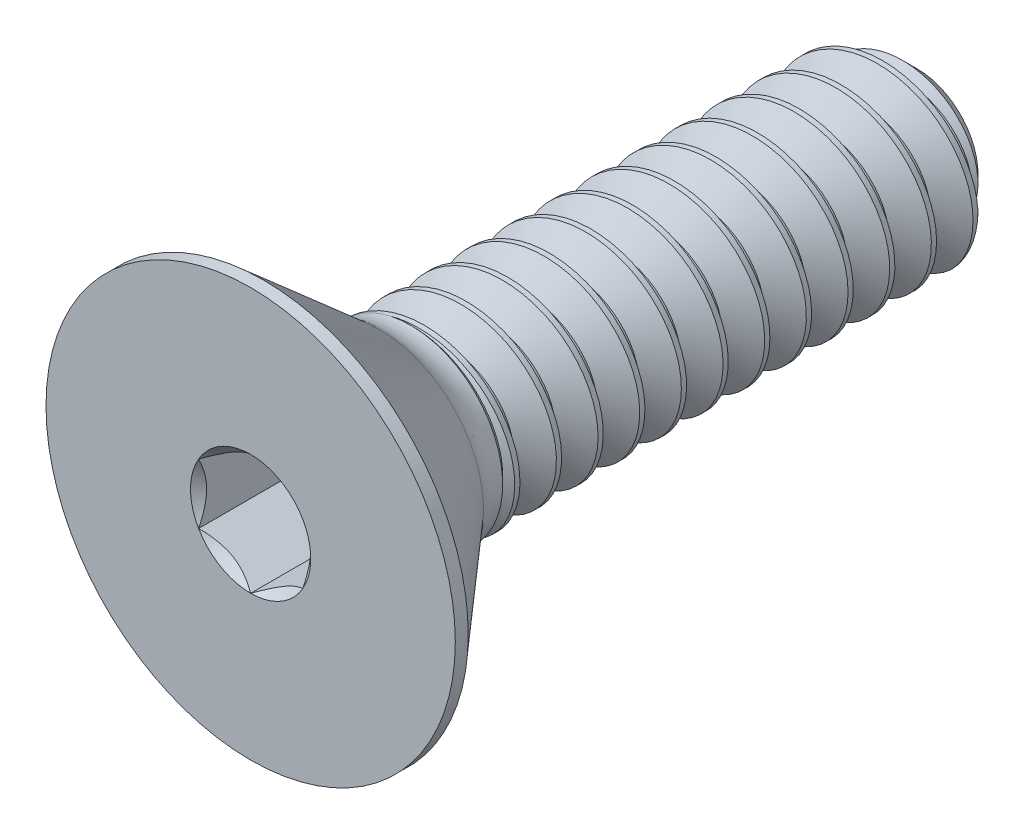
from build123d import *

# Parameters (mm, degrees)
SKETCH1_W          = 12.7
SKETCH1_H          = 1.7526
CHAMFER1_SIZE      = 0.5953125
CUT_SWEEP1_PITCH   = 0.79375
CUT_EXTRUDE2_DEPTH = 1.72466


with BuildPart() as part:
    # Sketch1 → Revolve1 (revolve)
    with BuildSketch(Plane(origin=(0, 0, 0), x_dir=(0, 0, -1), z_dir=(1, 0, 0))):
        with Locations((6.35, 0.8763)):
            Rectangle(SKETCH1_W, SKETCH1_H)
    revolve(axis=Axis((0, 0, -12.7), (0, 0, 1)))

    # Chamfer1
    chamfer1_edges = [part.edges().sort_by_distance(p)[0] for p in [
        (0, -1.7526, -12.7),
    ]]
    chamfer(chamfer1_edges, length=CHAMFER1_SIZE)

    # Cut-Sweep1: arcs per turn and ends read off the stored shape
    # Cut-Sweep1: the profile of Sketch2 profile screwed along a right-hand helix through 17 turns, 8 arcs to a turn; built about Z, then put on its axis
    cut_sweep1_z = Axis((0, 0, 0), (0, 0, 1))
    cut_sweep1_corners = [(1.7532, 0, 0.00034641), (1.7532, 0, -0.69487766), (1.237044252, 0, -0.396875), (1.237044252, 0, -0.29765625)]
    with BuildLine(mode=Mode.PRIVATE) as cut_sweep1_profile:
        Line(cut_sweep1_corners[0], cut_sweep1_corners[1])
        Line(cut_sweep1_corners[1], cut_sweep1_corners[2])
        Line(cut_sweep1_corners[2], cut_sweep1_corners[3])
        Line(cut_sweep1_corners[3], cut_sweep1_corners[0])
    cut_sweep1_cap = Face(cut_sweep1_profile.wire())
    cut_sweep1_turn_angles = [0, 22.5, 45, 67.5, 90, 112.5, 135, 157.5, 180, 202.5, 225, 247.5, 270, 292.5, 315, 337.5, 360]
    cut_sweep1_turn_weights = [1, 0.9238795325112867, 1, 0.9238795325112867, 1, 0.9238795325112867, 1, 0.9238795325112867, 1, 0.9238795325112867, 1, 0.9238795325112867, 1, 0.9238795325112867, 1, 0.9238795325112867, 1]
    cut_sweep1_turn_rails = [Edge.make_bspline([Vector(p[0], p[1], 0).rotate(cut_sweep1_z, cut_sweep1_turn_angles[k]) / cut_sweep1_turn_weights[k] + Vector(0, 0, p[2] + CUT_SWEEP1_PITCH * cut_sweep1_turn_angles[k] / 360) for k in range(17)], [0, 0, 0, 1, 1, 2, 2, 3, 3, 4, 4, 5, 5, 6, 6, 7, 7, 8, 8, 8], 2, cut_sweep1_turn_weights) for p in cut_sweep1_corners]
    cut_sweep1_turn_sides = [Face.make_surface_from_curves(cut_sweep1_turn_rails[p[0]], cut_sweep1_turn_rails[p[1]]) for p in [(0, 1), (1, 2), (2, 3), (3, 0)]]
    cut_sweep1 = Plane(origin=(0, 0, -12.7), x_dir=(0, 1, 0), z_dir=(0, 0, 1)) * Solid(Shell([*[p.moved(Location((0, 0, CUT_SWEEP1_PITCH * i))) for i in range(17) for p in cut_sweep1_turn_sides], cut_sweep1_cap, cut_sweep1_cap.rotate(cut_sweep1_z, 6120).moved(Location((0, 0, CUT_SWEEP1_PITCH * 6120 / 360)))]))
    add(cut_sweep1, mode=Mode.SUBTRACT)

    # Sketch7 → Revolve2 (revolve)
    with BuildSketch(Plane(origin=(0, 0, 0), x_dir=(0, 0, -1), z_dir=(1, 0, 0)), mode=Mode.PRIVATE) as revolve2_sk:
        with BuildLine():
            Line((0, 3.8989), (0.24638, 3.8989))
            Line((0.24638, 3.8989), (2.4638, 1.971326202))
            ThreePointArc((2.4638, 1.971326202), (2.73652883, 1.809069598), (3.048809801, 1.7526))
            Line((3.048809801, 1.7526), (3.048809801, 0))
            Line((3.048809801, 0), (0, 0))
            Line((0, 0), (0, 3.8989))
        make_face()
    revolve(revolve2_sk.sketch.rotate(Axis((0, 0, 0), (0, 0, -1)), 189.052465709), axis=Axis((0, 0, 0), (0, 0, -1)))

    # Boss-Extrude1 cone 1 section (through the dimple's axis) → Boss-Extrude1 (revolve)
    with BuildSketch(Plane(origin=(0, 0, -3.048809801), x_dir=(0, -1, 0), z_dir=(1, 0, 0))):
        Polygon((0, 0), (1.7526, 0), (0, 1.7526), align=None)
    revolve(axis=Axis((0, 0, -3.048809801), (0, 0, -1)))

    # Sketch5 → Cut-Extrude2 (cut)
    with BuildSketch(Plane.XY):
        Polygon((0.9921875, -0.57283972), (0.9921875, 0.57283972), (0, 1.14567944), (-0.9921875, 0.57283972), (-0.9921875, -0.57283972), (0, -1.14567944), align=None)
    extrude(amount=-CUT_EXTRUDE2_DEPTH, mode=Mode.SUBTRACT)

    # Cut-Extrude3 cone 1 section (through the dimple's axis) → Cut-Extrude3 (revolve, cut)
    with BuildSketch(Plane(origin=(0, 0, 0), x_dir=(0, -1, 0), z_dir=(1, 0, 0))):
        Polygon((0, 0), (1.14567944, 0), (0, 1.14567944), align=None)
    revolve(axis=Axis((0, 0, 0), (0, 0, -1)), mode=Mode.SUBTRACT)


solid = part.part
